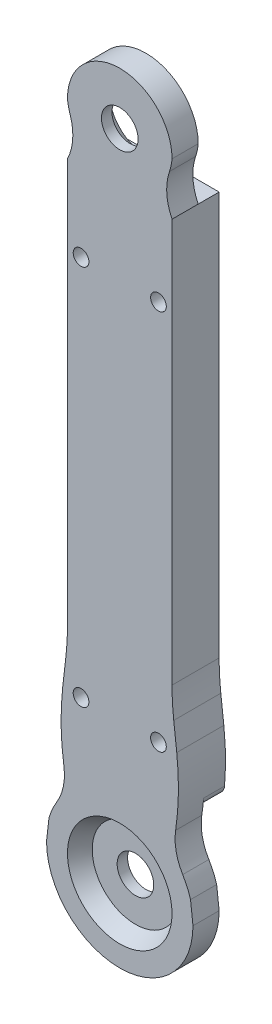
from build123d import *

# Parameters (mm, degrees)
BOSS_EXTRUDE1_DEPTH = 5
SKETCH2_W           = 20
SKETCH2_H           = 90.00000000000001
BOSS_EXTRUDE2_DEPTH = 5
CUT_EXTRUDE1_DEPTH  = 5
BOSS_EXTRUDE3_DEPTH = 4
SKETCH5_R           = 3.4999999999999996
CUT_EXTRUDE2_DEPTH  = 32
SKETCH6_R           = 10
CUT_EXTRUDE3_DEPTH  = 3
CUT_EXTRUDE3_DRAFT  = -30.000000000000068
SKETCH7_R           = 1.5
SKETCH7_R_2         = 1.5000000000000018
SKETCH7_R_3         = 1.5000000000000009
CUT_EXTRUDE4_DEPTH  = 127.10313239567049
CUT_EXTRUDE5_DEPTH  = 4
FILLET1_R           = 10
FILLET2_R           = 2
FILLET3_R           = 50
FILLET4_DEPTH       = 5
FILLET4_START       = -4
FILLET4_2_DEPTH     = 4.5281
FILLET5_R           = 2
SKETCH9_R           = 10.000000000000004
BOSS_EXTRUDE4_DEPTH = 5
CUT_EXTRUDE6_DEPTH  = 136.81605207043827
FILLET6_R           = 10
SKETCH12_R          = 7.000000000000002
CUT_EXTRUDE7_DEPTH  = 3
CUT_EXTRUDE7_DRAFT  = -30.000000000000068
SKETCH13_R          = 3.500000000000001
CUT_EXTRUDE8_DEPTH  = 136.90437814875574


with BuildPart() as part:
    # Sketch1 → Boss-Extrude1 (new body)
    with BuildSketch(Plane.XY):
        with BuildLine():
            Line((-10, 35), (-14, 0))
            ThreePointArc((-14.000000000000004, 0), (5.36e-15, -14.000000000000002), (14.000000000000007, 5.39e-15))
            Line((14, 0), (13.639000805801773, 3.1587429492344796))
            Line((13.639000805801773, 3.1587429492344796), (10, 35))
            Line((10, 35), (-10, 35))
        make_face()
    extrude(amount=BOSS_EXTRUDE1_DEPTH)

    # Sketch2 → Boss-Extrude2 (add)
    with BuildSketch(Plane.XY.offset(5)):
        with Locations((-8.9e-16, 80)):
            Rectangle(SKETCH2_W, SKETCH2_H)
    extrude(amount=-BOSS_EXTRUDE2_DEPTH)

    # Sketch3 → Cut-Extrude1 (cut)
    with BuildSketch(Plane(origin=(0, 0, 0), x_dir=(-1, 0, 0), z_dir=(0, 0, -1))):
        with BuildLine():
            Line((-13.531428571428568, 4.1), (-11.714285714285717, 20.000000000000004))
            Line((-11.714285714285717, 20.000000000000004), (-10, 10.097287013661564))
            ThreePointArc((-10, 10.097287013661564), (-12.138289126679721, 7.318029611811854), (-13.531428571428568, 4.1))
        make_face()
        with BuildLine():
            Line((11.714285714285717, 20.000000000000004), (10, 10.097287013661564))
            ThreePointArc((10, 10.097287013661564), (12.13828912667972, 7.318029611811857), (13.531428571428568, 4.1))
            Line((13.531428571428568, 4.1), (11.714285714285717, 20.000000000000004))
        make_face()
    extrude(amount=-CUT_EXTRUDE1_DEPTH, mode=Mode.SUBTRACT)

    # Sketch4 → Boss-Extrude3 (add)
    with BuildSketch(Plane(origin=(0, 0, 0), x_dir=(-1, 0, 0), z_dir=(0, 0, -1))):
        with BuildLine():
            Line((11.714285714285715, 20.000000000000007), (10.663491421845874, 13.93))
            ThreePointArc((10.663491421845874, 13.93), (1.07e-15, 17.541117308183576), (-10.663491421845876, 13.93))
            Line((-10.663491421845876, 13.93), (-11.714285714285717, 20.000000000000004))
            Line((-11.714285714285717, 20.000000000000004), (-10, 35))
            Line((-10, 35), (-9.999999999999998, 115))
            Line((-9.999999999999998, 115), (9.999999999999986, 115))
            Line((9.999999999999986, 115), (10.000000000000002, 35))
            Line((10.000000000000002, 35), (11.714285714285715, 20.000000000000007))
        make_face()
    extrude(amount=BOSS_EXTRUDE3_DEPTH)

    # Sketch5 → Cut-Extrude2 (cut)
    with BuildSketch(Plane(origin=(0, 0, 0), x_dir=(-1, 0, 0), z_dir=(0, 0, -1))):
        Circle(SKETCH5_R)
    extrude(amount=-CUT_EXTRUDE2_DEPTH, mode=Mode.SUBTRACT)


with BuildPart() as cut_extrude3_tool:
    # Sketch6 → Cut-Extrude3 (with draft: the straight prism first)
    with BuildSketch(Plane.XY.offset(5)):
        Circle(SKETCH6_R)
    extrude(amount=-CUT_EXTRUDE3_DEPTH)
    # Cut-Extrude3: the draft: its side faces are tilted about the plane it starts from
    cut_extrude3_sides = [cut_extrude3_tool.faces().sort_by_distance(p)[0] for p in [
        (-10, 0, 3.5),
    ]]
    draft(cut_extrude3_sides, Plane.XY.offset(5), CUT_EXTRUDE3_DRAFT)


with BuildPart() as part_1:
    add(part.part)

    # Cut-Extrude3: cut by cut_extrude3_tool
    add(cut_extrude3_tool.part, mode=Mode.SUBTRACT)

    # Sketch7 → Cut-Extrude4 (cut, through all)
    with BuildSketch(Plane.XY.offset(5)):
        with Locations((-7.40000000000001, 27.090000000000003)):
            Circle(SKETCH7_R)
        with Locations((7.40000000000001, 27.090000000000003)):
            Circle(SKETCH7_R_2)
        with Locations((-7.4, 100)):
            Circle(SKETCH7_R)
        with Locations((7.4, 100)):
            Circle(SKETCH7_R_3)
    extrude(amount=-CUT_EXTRUDE4_DEPTH, mode=Mode.SUBTRACT)

    # Sketch8 → Cut-Extrude5 (cut)
    with BuildSketch(Plane(origin=(0, 0, -4), x_dir=(-1, 0, 0), z_dir=(0, 0, -1))):
        Polygon((3.0000000000000036, 115), (-3, 115), (-2.999999999999998, 100), (-6.999999999999996, 91.14510297951342), (-6.999999999999996, 41.14510297951343), (-2.999999999999998, 32.29020595902685), (-3, 17.290205959026846), (3.000000000000001, 17.290205959026846), (2.9999999999999987, 32.29020595902685), (6.999999999999997, 41.14510297951343), (6.999999999999999, 91.14510297951342), (3.0000000000000004, 100), align=None)
    extrude(amount=-CUT_EXTRUDE5_DEPTH, mode=Mode.SUBTRACT)

    # Fillet1
    fillet1_edges = [part_1.edges().sort_by_distance(p)[0] for p in [
        (2.999999999999998, 32.29020595902685, -2),
        (6.999999999999996, 41.14510297951343, -2),
        (6.999999999999996, 91.14510297951342, -2),
        (2.999999999999998, 100, -2),
        (-3.0000000000000004, 100, -2),
        (-6.999999999999999, 91.14510297951342, -2),
        (-6.999999999999997, 41.14510297951343, -2),
        (-2.9999999999999987, 32.29020595902685, -2),
    ]]
    fillet(fillet1_edges, radius=FILLET1_R)

    # Fillet2
    # the kernel refuses this fillet: 2 mm, written as the material it adds along each edge
    with BuildSketch(Plane(origin=(3, 17.290205959026846, -4), x_dir=(0, 1, 0), z_dir=(0, 0, 1))) as fillet2_piece_1:
        with BuildLine():
            CenterArc((0.4123469241082738, 2), FILLET2_R, 258.1017989738068, 11.898201026193192)
            Line((-3.55e-15, 0.0429690819564339), (0, 0))
            Line((0, 0), (0.4123469241082738, 0))
        make_face()
    extrude(amount=5.0308673102706845)
    # the kernel refuses this fillet: 2 mm, written as the material it takes off along each edge
    with BuildSketch(Plane(origin=(-2.957030918043564, 17.290205959026842, -4.509899036073291), x_dir=(-0.9847073408131305, -0.17421668389891107, 0), z_dir=(0, 0, 1))) as fillet2_2_piece_1:
        with BuildLine():
            CenterArc((0.21558124488116945, -1.9999662341413758), FILLET2_R, 90.33293706162901, 4.637092426226772)
            Line((0.04231197043050394, -0.00748593096863449), (0, 0))
            ThreePointArc((0, 0), (0.10197980721465859, -0.00029629540941332), (0.20395961442931643, 0))
        make_face()
    extrude(amount=4.509899036073291, mode=Mode.SUBTRACT)
    with BuildSketch(Plane(origin=(-3.0000000000000036, 115, -9), x_dir=(0, -1, 0), z_dir=(0, 0, 1))) as fillet2_2_piece_2:
        with BuildLine():
            CenterArc((FILLET2_R, -FILLET2_R), FILLET2_R, 90, 89.99999999999994)
            Line((0, -FILLET2_R), (0, 0))
            Line((0, 0), (FILLET2_R, 0))
        make_face()
    extrude(amount=9, mode=Mode.SUBTRACT)
    with BuildSketch(Plane(origin=(3, 115, -9), x_dir=(1, 0, 0), z_dir=(0, 0, 1))) as fillet2_2_piece_3:
        with BuildLine():
            CenterArc((FILLET2_R, -FILLET2_R), FILLET2_R, 90, 90)
            Line((0, -FILLET2_R), (0, 0))
            Line((0, 0), (FILLET2_R, 0))
        make_face()
    extrude(amount=9, mode=Mode.SUBTRACT)

    # Fillet3
    fillet3_edges = [part_1.edges().sort_by_distance(p)[0] for p in [
        (10, 35, 0.5),
        (-10, 35, 0.5),
        (-11.714285714285715, 20.000000000000007, 0.5),
        (11.714285714285717, 20.000000000000004, 0.5),
    ]]
    fillet(fillet3_edges, radius=FILLET3_R)

    # Fillet4: read off the stored shape, not the designer's step
    # Fillet4 outline → Fillet4 (add)
    with BuildSketch(Plane.XY):
        with BuildLine():
            ThreePointArc((-12.034442383, 7.491554566), (-11.093201481, 8.85374289), (-10, 10.097287014))
            Line((-10, 10.097287014), (-10.489743981, 12.926333563))
            ThreePointArc((-10.489743981, 12.926333563), (-10.591568808, 13.537003207), (-10.685824653, 14.148886811))
            ThreePointArc((-10.685824653, 14.148886811), (-10.777565635, 10.702206243), (-12.034442383, 7.491554566))
        make_face()
        with BuildLine():
            ThreePointArc((10.685824653, 14.148886811), (10.591568808, 13.537003207), (10.489743981, 12.926333563))
            Line((10.489743981, 12.926333563), (10, 10.097287014))
            ThreePointArc((10, 10.097287014), (11.093201481, 8.85374289), (12.034442383, 7.491554566))
            ThreePointArc((12.034442383, 7.491554566), (10.777565635, 10.702206243), (10.685824653, 14.148886811))
        make_face()
    extrude(amount=FILLET4_DEPTH)

    # Fillet4 2 outline → Fillet4 2 (add)
    with BuildSketch(Plane.XY.offset(FILLET4_START)):
        with BuildLine():
            ThreePointArc((-10.685824653, 14.148886811), (-10.670645953, 14.042149596), (-10.656618864, 13.935254943))
            ThreePointArc((-10.656618864, 13.935254943), (-10.655355047, 13.936220708), (-10.654091142, 13.937186359))
            ThreePointArc((-10.654091142, 13.937186359), (-10.670071192, 14.043019602), (-10.685824653, 14.148886811))
        make_face()
        with BuildLine():
            ThreePointArc((10.656618864, 13.935254943), (10.670645953, 14.042149596), (10.685824653, 14.148886811))
            ThreePointArc((10.685824653, 14.148886811), (10.670071192, 14.043019602), (10.654091141, 13.937186358))
            ThreePointArc((10.654091141, 13.937186358), (10.655355047, 13.936220708), (10.656618864, 13.935254943))
        make_face()
    extrude(amount=FILLET4_2_DEPTH)

    # Fillet5
    # the kernel refuses this fillet: 2 mm, written as the material it takes off along each edge
    with BuildSketch(Plane(origin=(-10.656618864, 13.935254943, -12.09556862181672), x_dir=(0.8436487743277257, 0.5368954698778211, 0), z_dir=(0, 0, 1))) as fillet5_piece_1:
        with BuildLine():
            CenterArc((3.1791827490453266, 1.9926433067767657), FILLET5_R, 152.46563486341088, 112.61853158765763)
            Line((1.4057153013326045, 2.9172043982700875), (1.2283685565613318, 3.0096605074194187))
            ThreePointArc((1.2283685565613318, 3.0096605074194187), (-0.09255081820002803, 0.2774816540598466), (-0.1808082004145864, 0.08548914938656571))
            Line((-0.1808082004145864, 0.08548914938656571), (0.01713850646766271, -0.19926432594937338))
            ThreePointArc((0.01713850646766271, -0.19926432594937338), (0.02027181051916814, -0.198995120599251), (2.990659782622436, -0.1992643306776759))
            Line((2.990659782622436, -0.1992643306776759), (3.0077982341154264, -1.7e-16))
        make_face()
    extrude(amount=12.09556862181672, mode=Mode.SUBTRACT)
    with BuildSketch(Plane(origin=(10.656618863999999, 13.935254943, -12.095568621816739), x_dir=(-0.8436487743277254, 0.5368954698778213, 0), z_dir=(0, 0, 1))) as fillet5_piece_2:
        with BuildLine():
            CenterArc((3.179182749045327, -1.9926433067767648), FILLET5_R, 94.91583354893154, 112.61853158765777)
            Line((1.4057153013326076, -2.9172043982700937), (1.228368556561337, -3.009660507419428))
            ThreePointArc((1.228368556561337, -3.009660507419428), (-0.09255081820002496, -0.2774816540598447), (-0.18080820041458637, -0.08548914938656577))
            Line((-0.18080820041458637, -0.08548914938656577), (0.01713859427019769, 0.19926431839755343))
            ThreePointArc((0.01713859427019769, 0.19926431839755343), (0.02027181051918035, 0.19899512059924826), (2.9906597826224344, 0.199264330677676))
            Line((2.9906597826224344, 0.199264330677676), (3.007798234115425, 9e-17))
        make_face()
    extrude(amount=12.095568621816739, mode=Mode.SUBTRACT)

    # Sketch9 → Boss-Extrude4 (add)
    with BuildSketch(Plane(origin=(0, 0, 0), x_dir=(-1, 0, 0), z_dir=(0, 0, -1))):
        with Locations((1.73e-15, 125)):
            Circle(SKETCH9_R)
    extrude(amount=-BOSS_EXTRUDE4_DEPTH)

    # Sketch11 → Cut-Extrude6 (cut, through all)
    with BuildSketch(Plane(origin=(0, 0, 0), x_dir=(-1, 0, 0), z_dir=(0, 0, -1))):
        with BuildLine():
            Line((-9.999999999999998, 115), (-10.000000000000002, 125))
            ThreePointArc((-10.000000000000002, 125), (-9.21839383454114, 121.90275741168345), (-7.499999999999998, 119.21000000000001))
            Line((-7.499999999999998, 119.21000000000001), (-9.999999999999998, 115))
        make_face()
        with BuildLine():
            Line((10.000000000000002, 115), (7.5000000000000036, 119.21000000000001))
            ThreePointArc((7.5000000000000036, 119.21000000000001), (9.218393834541143, 121.90275741168345), (10.000000000000005, 125))
            Line((10.000000000000005, 125), (10.000000000000002, 115))
        make_face()
    extrude(amount=-CUT_EXTRUDE6_DEPTH, mode=Mode.SUBTRACT)

    # Fillet6
    # the kernel refuses this fillet: 10 mm, written as the material it adds along each edge
    with BuildSketch(Plane(origin=(7.499999999999999, 119.21000000000001, 0), x_dir=(0.5105859411129599, -0.859826724833436, 0), z_dir=(0, 0, 1))) as fillet6_piece_1:
        with BuildLine():
            CenterArc((5.675884841968563, 9.96956882778365), FILLET6_R, 220.4927276915396, 45.036246603568316)
            Line((-1.928999069434184, 3.476053547591599), (-2.081096747662235, 3.3461832419877546))
            ThreePointArc((-2.081096747662235, 3.3461832419877546), (-0.9649011887903164, 1.7378038801254725), (-0.19067765961673533, -0.06034923465201128))
            Line((-0.19067765961673533, -0.06034923465201128), (-8.127e-14, -0.19999999999999948))
            ThreePointArc((-8.127e-14, -0.19999999999999948), (2.4481676821655842, -0.2000000000009927), (4.88074437477858, -0.19939137655567607))
            Line((4.88074437477858, -0.19939137655567607), (4.89633536433132, 7e-17))
        make_face()
    extrude(amount=5)
    with BuildSketch(Plane(origin=(-7.500000000000004, 119.21000000000001, 0), x_dir=(-0.510585941112954, -0.8598267248334394, 0), z_dir=(0, 0, 1))) as fillet6_piece_2:
        with BuildLine():
            CenterArc((5.675884841968524, -9.969568827783654), FILLET6_R, 94.47102570489186, 45.036246603568216)
            Line((-1.928999069434189, -3.4760535475915604), (-2.081096747662239, -3.3461832419877147))
            ThreePointArc((-2.081096747662239, -3.3461832419877147), (-0.9649011887903213, -1.7378038801254492), (-0.19067765961673488, 0.06034923465201256))
            Line((-0.19067765961673488, 0.06034923465201256), (-7.992e-14, 0.19999999999999946))
            ThreePointArc((-7.992e-14, 0.19999999999999946), (2.448167682165587, 0.20000000000097304), (4.880744374778577, 0.19939137655567624))
            Line((4.880744374778577, 0.19939137655567624), (4.896335364331317, 1.8e-16))
        make_face()
    extrude(amount=5)


with BuildPart() as cut_extrude7_tool:
    # Sketch12 → Cut-Extrude7 (with draft: the straight prism first)
    with BuildSketch(Plane(origin=(0, 0, 0), x_dir=(-1, 0, 0), z_dir=(0, 0, -1))):
        with Locations((1.73e-15, 125)):
            Circle(SKETCH12_R)
    extrude(amount=-CUT_EXTRUDE7_DEPTH)
    # Cut-Extrude7: the draft: its side faces are tilted about the plane it starts from
    cut_extrude7_sides = [cut_extrude7_tool.faces().sort_by_distance(p)[0] for p in [
        (7, 125, 1.5),
    ]]
    draft(cut_extrude7_sides, Plane(origin=(0, 0, 0), x_dir=(-1, 0, 0), z_dir=(0, 0, -1)), CUT_EXTRUDE7_DRAFT)


with BuildPart() as part_2:
    add(part_1.part)

    # Cut-Extrude7: cut by cut_extrude7_tool
    add(cut_extrude7_tool.part, mode=Mode.SUBTRACT)

    # Sketch13 → Cut-Extrude8 (cut, through all)
    with BuildSketch(Plane(origin=(0, 0, 3), x_dir=(-1, 0, 0), z_dir=(0, 0, -1))):
        with Locations((1.73e-15, 125)):
            Circle(SKETCH13_R)
    extrude(amount=-CUT_EXTRUDE8_DEPTH, mode=Mode.SUBTRACT)


solid = part_2.part
